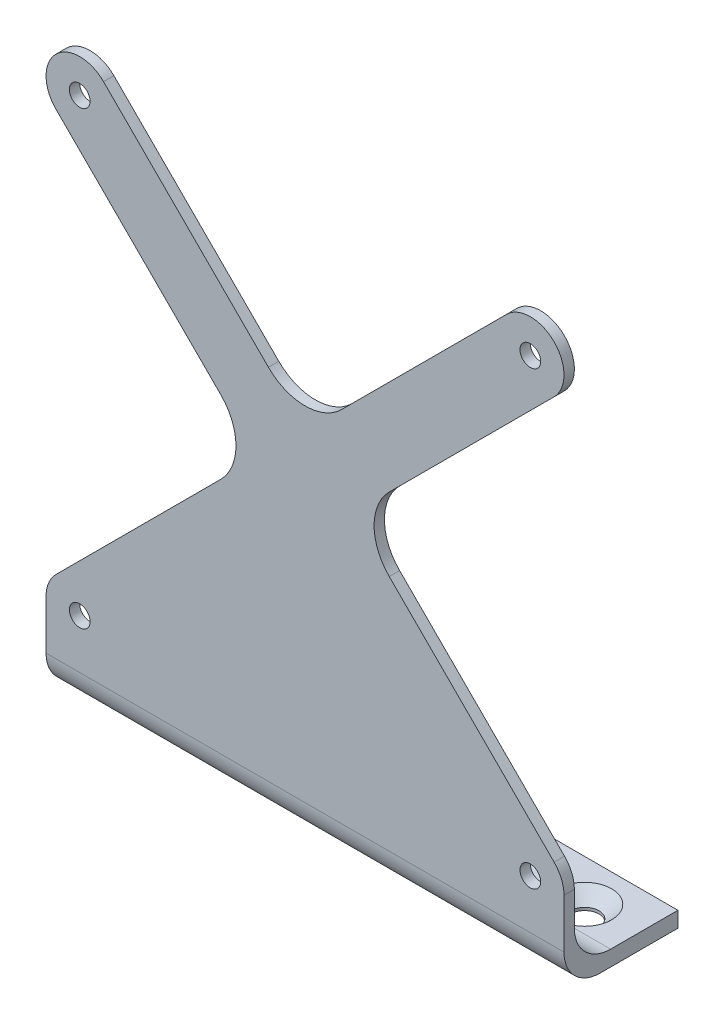
from build123d import *

# Parameters (mm, degrees)
ESQUISSE1_W                                 = 100
ESQUISSE1_H                                 = 110
BOSS_EXTRU_1_DEPTH                          = 2
ESQUISSE3_W                                 = 100
ESQUISSE3_H                                 = 20
BOSS_EXTRU_2_DEPTH                          = 3
FRAISAGE_POUR_VIS_T_TE_FRAIS_E_M51_AT_COUNT = 2
FRAISAGE_POUR_VIS_T_TE_FRAIS_E_M51_AT_PITCH = 80
ESQUISSE6_R                                 = 2
ENL_V_MAT_EXTRU_1_DEPTH                     = 78.517739905
CONG_1_R                                    = 7
ENL_V_MAT_EXTRU_2_DEPTH                     = 78.517740041
CONG_2_R                                    = 10


with BuildPart() as part:
    # Esquisse1 → Boss.-Extru.1 (new body)
    with BuildSketch(Plane.XY):
        Rectangle(ESQUISSE1_W, ESQUISSE1_H)
    extrude(amount=BOSS_EXTRU_1_DEPTH)

    # Esquisse3 → Boss.-Extru.2 (add)
    with BuildSketch(Plane.XZ.offset(55)):
        with Locations((0, -10)):
            Rectangle(ESQUISSE3_W, ESQUISSE3_H)
    extrude(amount=-BOSS_EXTRU_2_DEPTH)

    # Esquisse5 → Fraisage pour vis à tête fraisée M51 (revolve, cut)
    with BuildSketch(Plane(origin=(-40, -52, -12), x_dir=(0, 0, 1), z_dir=(1, 0, 0))):
        Polygon((0, 0), (0, 3), (2.75, 3), (2.75, 2.45), (5.2, 0), align=None)
    fraisage_pour_vis_t_te_frais_e_m51 = revolve(axis=Axis((-40, -45.65, -12), (0, -1, 0)), mode=Mode.SUBTRACT)

    # Fraisage pour vis à tête fraisée M51 at: Fraisage pour vis à tête fraisée M51 ×2
    with Locations(*[(i * FRAISAGE_POUR_VIS_T_TE_FRAIS_E_M51_AT_PITCH, 0, 0) for i in range(1, FRAISAGE_POUR_VIS_T_TE_FRAIS_E_M51_AT_COUNT)]):
        add(fraisage_pour_vis_t_te_frais_e_m51, mode=Mode.SUBTRACT)

    # Esquisse6 → Enlèv. mat.-Extru.1 (cut, through all)
    with BuildSketch(Plane.XY.offset(2)):
        with Locations((-43.5, 48.5)):
            Circle(ESQUISSE6_R)
        with Locations((43.5, 48.5)):
            Circle(ESQUISSE6_R)
        with Locations((-43.5, -38.5)):
            Circle(ESQUISSE6_R)
        with Locations((43.5, -38.5)):
            Circle(ESQUISSE6_R)
    extrude(amount=-ENL_V_MAT_EXTRU_1_DEPTH, mode=Mode.SUBTRACT)

    # Congé1
    cong_1_edges = [part.edges().sort_by_distance(p)[0] for p in [
        (0, -52, 0),
        (0, -55, 2),
    ]]
    fillet(cong_1_edges, radius=CONG_1_R)

    # Esquisse7 → Enlèv. mat.-Extru.2 (cut, through all)
    with BuildSketch(Plane.XY.offset(2)):
        with BuildLine():
            Line((0, 55), (-43.500000007, 55))
            ThreePointArc((-43.500000007, 55), (-41.012557693, 54.505216963), (-38.903805922, 53.096194078))
            Line((-38.903805922, 53.096194078), (0, 14.192388155))
            Line((0, 14.192388155), (0, 55))
        make_face()
        with BuildLine():
            Line((-50, 55), (-50, 48.5))
            ThreePointArc((-50, 48.5), (-48.09619408, 53.096194075), (-43.500000007, 55))
            Line((-43.500000007, 55), (-50, 55))
        make_face()
        with BuildLine():
            Line((-9.192388155, 5), (-48.096194078, 43.903805922))
            ThreePointArc((-48.096194078, 43.903805922), (-49.505216961, 46.01255769), (-50, 48.5))
            Line((-50, 48.5), (-50, -38.5))
            ThreePointArc((-50, -38.5), (-49.505216961, -36.01255769), (-48.096194078, -33.903805922))
            Line((-48.096194078, -33.903805922), (-9.192388155, 5))
        make_face()
    enl_v_mat_extru_2 = extrude(amount=-ENL_V_MAT_EXTRU_2_DEPTH, mode=Mode.SUBTRACT)

    # Symétrie1: Enlèv. mat.-Extru.2 across plane
    add(enl_v_mat_extru_2.mirror(Plane(origin=(0, 0, 0), x_dir=(0, 0, 1), z_dir=(1, 0, 0))), mode=Mode.SUBTRACT)

    # Congé2
    cong_2_edges = [part.edges().sort_by_distance(p)[0] for p in [
        (9.192388155, 5, 1),
        (0, 14.192388155, 1),
        (-9.192388155, 5, 1),
    ]]
    fillet(cong_2_edges, radius=CONG_2_R)


solid = part.part
